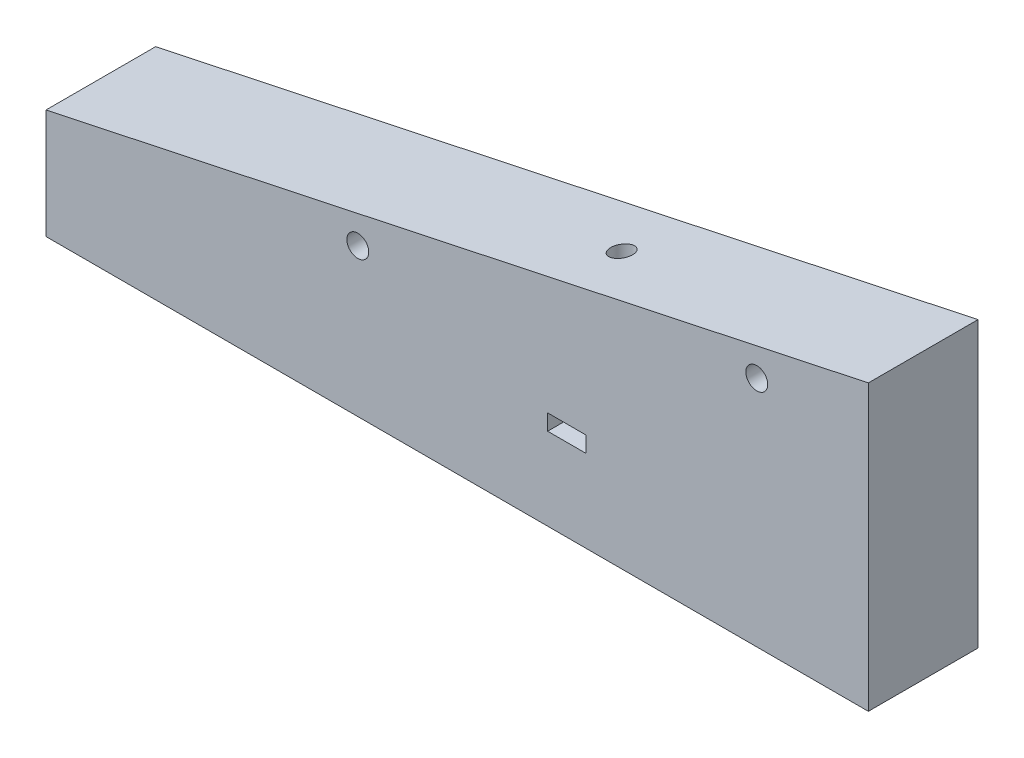
from build123d import *

# Parameters (mm, degrees)
SKETCH1_W               = 150
SKETCH1_H               = 20
BOSS_EXTRUDE1_DEPTH     = 10
BOSS_EXTRUDE2_DEPTH     = 10
CUT_EXTRUDE1_DEPTH      = 92.743642493
CUT_EXTRUDE1_DEPTH_BACK = 92.743642493
SKETCH3_R               = 2
SKETCH4_W               = 7
SKETCH4_H               = 2.9
CUT_EXTRUDE2_DEPTH      = 13.8
CUT_EXTRUDE3_DEPTH      = 89.199922069
CUT_EXTRUDE3_DEPTH_BACK = 89.199922069
SKETCH5_R               = 2


with BuildPart() as part:
    # Sketch1 → Boss-Extrude1 (new, symmetric)
    with BuildSketch(Plane(origin=(0, 0, 0), x_dir=(1, 0, 0), z_dir=(0, 1, 0))):
        Rectangle(SKETCH1_W, SKETCH1_H)
    extrude(amount=BOSS_EXTRUDE1_DEPTH, both=True)

    # Sketch2 → Boss-Extrude2 (add, symmetric)
    with BuildSketch(Plane.XY):
        Polygon((-75, 10), (75, 10), (75, 41.883484251), align=None)
    extrude(amount=BOSS_EXTRUDE2_DEPTH, both=True)

    # Sketch3 → Cut-Extrude1 (cut, two sides: drawn at the far end of the back side and taken through both)
    with BuildSketch(Plane.XZ.offset(10).offset(-CUT_EXTRUDE1_DEPTH_BACK)):
        with Locations((20, 0)):
            Circle(SKETCH3_R)
    extrude(amount=CUT_EXTRUDE1_DEPTH + CUT_EXTRUDE1_DEPTH_BACK, mode=Mode.SUBTRACT)

    # Sketch4 → Cut-Extrude2 (cut)
    with BuildSketch(Plane.XY.offset(10)):
        with Locations((20, 6.45)):
            Rectangle(SKETCH4_W, SKETCH4_H)
    extrude(amount=-CUT_EXTRUDE2_DEPTH, mode=Mode.SUBTRACT)

    # Sketch5 → Cut-Extrude3 (cut, two sides: drawn at the far end of the back side and taken through both)
    with BuildSketch(Plane.XY.offset(10).offset(-CUT_EXTRUDE3_DEPTH_BACK)):
        with Locations((-18.128219932, 16.976767053)):
            Circle(SKETCH5_R)
        with Locations((54.647581809, 32.445741244)):
            Circle(SKETCH5_R)
    extrude(amount=CUT_EXTRUDE3_DEPTH + CUT_EXTRUDE3_DEPTH_BACK, mode=Mode.SUBTRACT)


solid = part.part
